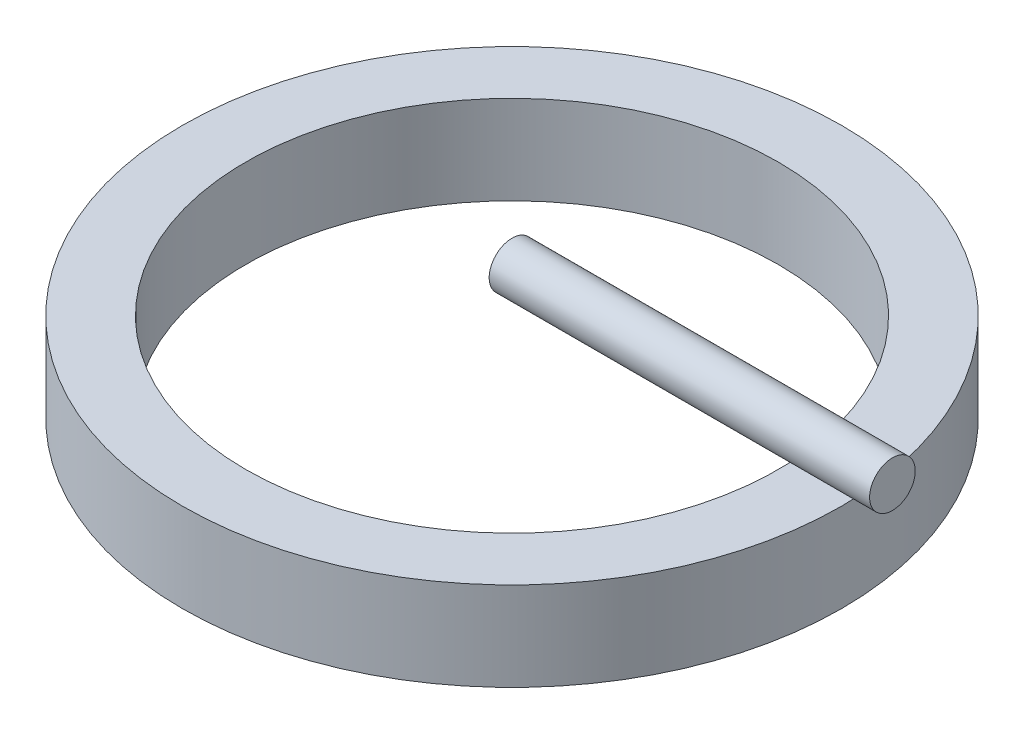
from build123d import *

# Parameters (mm, degrees)
SKETCH1_R           = 13000
SKETCH1_R_2         = 10500
BOSS_EXTRUDE1_DEPTH = 3500
SKETCH2_R           = 900
BOSS_EXTRUDE2_DEPTH = 15000


with BuildPart() as part:
    # Sketch1 → Boss-Extrude1 (new body)
    with BuildSketch(Plane(origin=(0, 0, 0), x_dir=(1, 0, 0), z_dir=(0, 1, 0))):
        Circle(SKETCH1_R)
        Circle(SKETCH1_R_2, mode=Mode.SUBTRACT)
    extrude(amount=-BOSS_EXTRUDE1_DEPTH)


with BuildPart() as body_2:
    # Sketch2 → Boss-Extrude2 (new body)
    with BuildSketch(Plane(origin=(0, 0, 0), x_dir=(0, 0, -1), z_dir=(1, 0, 0))):
        with Locations((0, 1750)):
            Circle(SKETCH2_R)
    extrude(amount=BOSS_EXTRUDE2_DEPTH)


solid = Compound([part.part, body_2.part])
